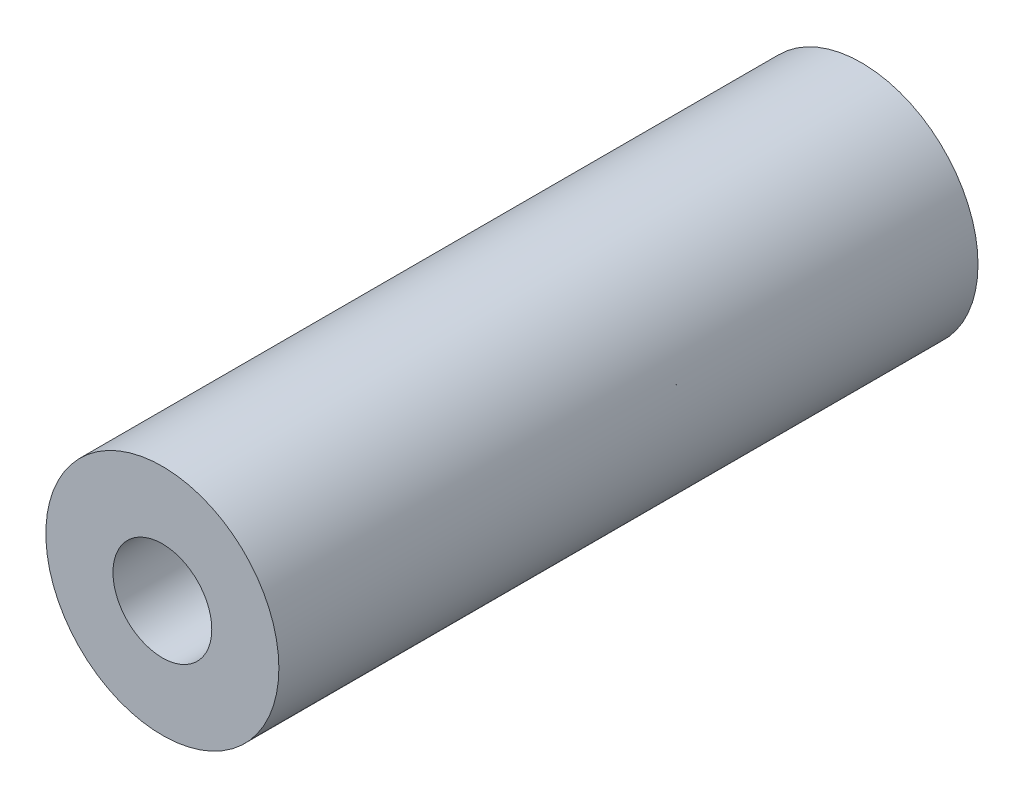
from build123d import *

# Parameters (mm, degrees)
SKETCH1_R                            = 4.7625
BOSS_EXTRUDE1_DEPTH                  = 14.2875
F_10_32_TAPPED_HOLE2_D               = 4.0386
F_10_32_TAPPED_HOLE2_DEPTH           = 15.07744
F_10_32_TAPPED_HOLE2_TIP             = 1.213317848
F_10_32_TAPPED_HOLE2_ON_FACE_2_D     = 4.0386
F_10_32_TAPPED_HOLE2_ON_FACE_2_DEPTH = 15.07744
F_10_32_TAPPED_HOLE2_ON_FACE_2_TIP   = 1.213317848


with BuildPart() as part:
    # Sketch1 → Boss-Extrude1 (new, symmetric)
    with BuildSketch(Plane.XY):
        Circle(SKETCH1_R)
    extrude(amount=BOSS_EXTRUDE1_DEPTH, both=True)

    # #10-32 Tapped Hole2
    with Locations(Plane.XY.offset(14.2875)):
        with Locations((0, 0)):
            Hole(F_10_32_TAPPED_HOLE2_D / 2, depth=F_10_32_TAPPED_HOLE2_DEPTH)
            with Locations((0, 0, -(F_10_32_TAPPED_HOLE2_DEPTH + F_10_32_TAPPED_HOLE2_TIP / 2))):  # 118° drill point
                Cone(0, F_10_32_TAPPED_HOLE2_D / 2, F_10_32_TAPPED_HOLE2_TIP, mode=Mode.SUBTRACT)

    # #10-32 Tapped Hole2 on face 2
    with Locations(Plane(origin=(0, 0, -14.2875), x_dir=(-1, 0, 0), z_dir=(0, 0, -1))):
        with Locations((0, 0)):
            Hole(F_10_32_TAPPED_HOLE2_ON_FACE_2_D / 2, depth=F_10_32_TAPPED_HOLE2_ON_FACE_2_DEPTH)
            with Locations((0, 0, -(F_10_32_TAPPED_HOLE2_ON_FACE_2_DEPTH + F_10_32_TAPPED_HOLE2_ON_FACE_2_TIP / 2))):  # 118° drill point
                Cone(0, F_10_32_TAPPED_HOLE2_ON_FACE_2_D / 2, F_10_32_TAPPED_HOLE2_ON_FACE_2_TIP, mode=Mode.SUBTRACT)


solid = part.part
